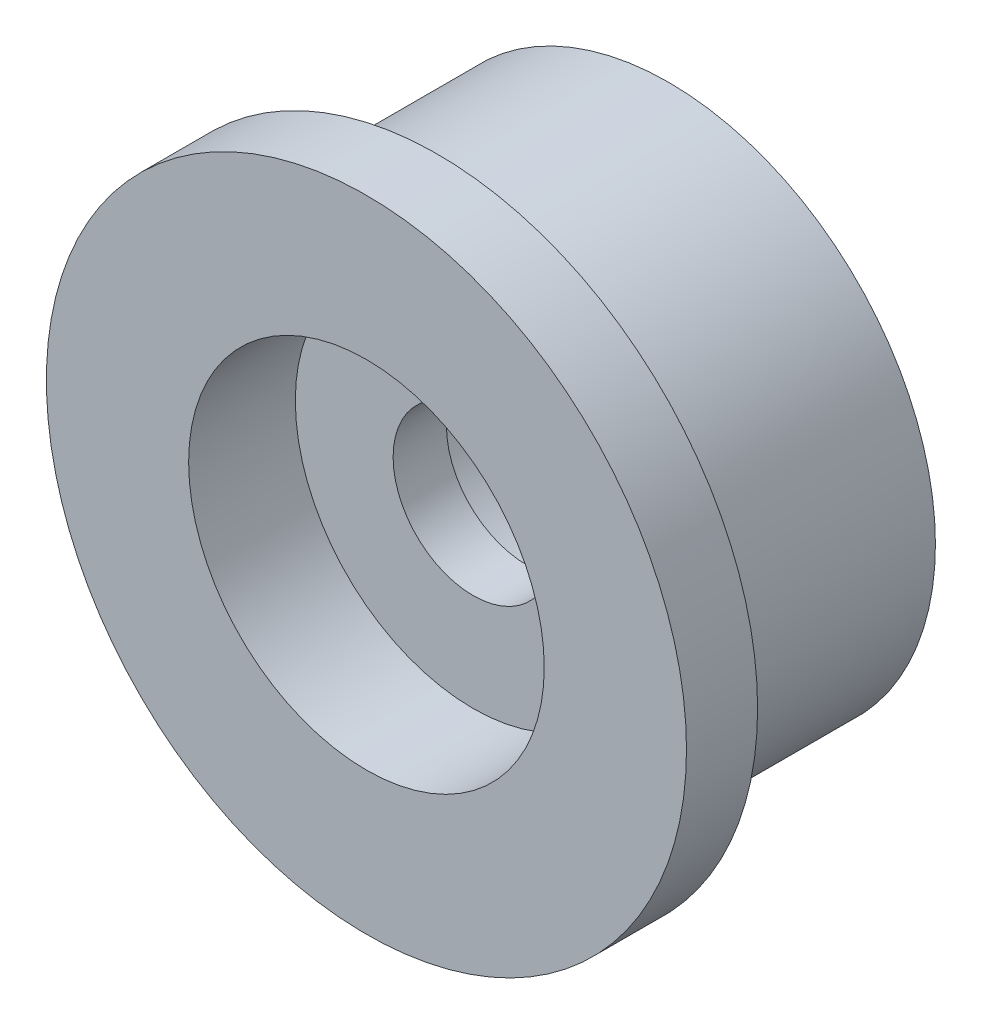
from build123d import *

# Parameters (mm, degrees)
SKETCH_1_R               = 9
EXTRUDE_1_DEPTH          = 2
SKETCH_2_R               = 7.5
EXTRUDE_2_DEPTH          = 6.5
SKETCH_5_R               = 3.9
CUT_EXTRUDE_3_DEPTH      = 4
SKETCH_6_R               = 2.25
CUT_EXTRUDE_4_DEPTH      = 16.305227865
CUT_EXTRUDE_5_DEPTH      = 2
CUT_EXTRUDE_5_DEPTH_BACK = 1
SKETCH_7_R               = 5


with BuildPart() as part:
    # 草图1 → 凸台-拉伸1 (new body)
    with BuildSketch(Plane.XY):
        Circle(SKETCH_1_R)
    extrude(amount=EXTRUDE_1_DEPTH)

    # 草图2 → 凸台-拉伸2 (add)
    with BuildSketch(Plane.XY):
        Circle(SKETCH_2_R)
    extrude(amount=-EXTRUDE_2_DEPTH)

    # 草图5 → 切除-拉伸3 (cut)
    with BuildSketch(Plane(origin=(0, 0, -6.5), x_dir=(-1, 0, 0), z_dir=(0, 0, -1))):
        Circle(SKETCH_5_R)
    extrude(amount=-CUT_EXTRUDE_3_DEPTH, mode=Mode.SUBTRACT)

    # 草图6 → 切除-拉伸4 (cut, through all)
    with BuildSketch(Plane(origin=(0, 0, -6.5), x_dir=(-1, 0, 0), z_dir=(0, 0, -1))):
        Circle(SKETCH_6_R)
    extrude(amount=-CUT_EXTRUDE_4_DEPTH, mode=Mode.SUBTRACT)

    # 草图7 → 切除-拉伸5 (cut, two sides: drawn at the far end of the back side and taken through both)
    with BuildSketch(Plane.XY.offset(-CUT_EXTRUDE_5_DEPTH_BACK)):
        Circle(SKETCH_7_R)
    extrude(amount=CUT_EXTRUDE_5_DEPTH + CUT_EXTRUDE_5_DEPTH_BACK, mode=Mode.SUBTRACT)


solid = part.part
